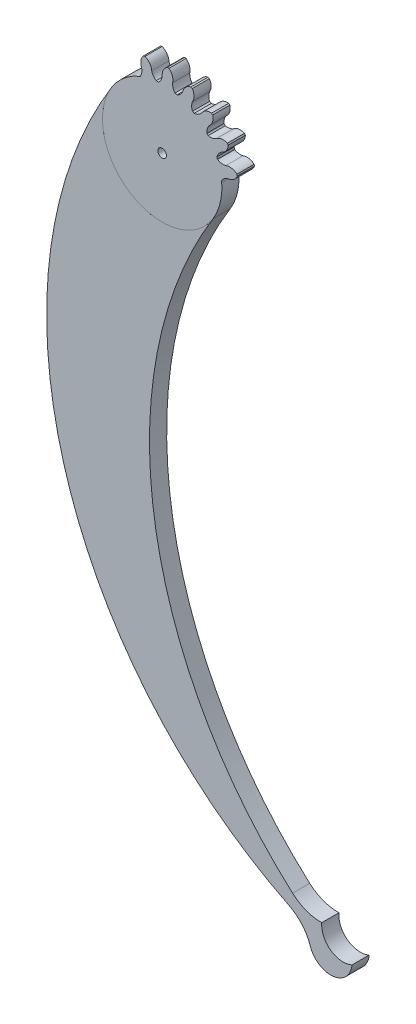
from build123d import *

# Parameters (mm, degrees)
ESQUISSE1_R             = 18
BOSS_EXTRU_1_DEPTH      = 4
ESQUISSE3_R             = 1
ENL_V_MAT_EXTRU_3_DEPTH = 26.768197453
BOSS_EXTRU_2_DEPTH      = 4
CONG_1_R                = 10


with BuildPart() as part:
    # Esquisse1 → Boss.-Extru.1 (new body)
    with BuildSketch(Plane.XY):
        Circle(ESQUISSE1_R)
    extrude(amount=BOSS_EXTRU_1_DEPTH)

    # Esquisse3 → Enlèv. mat.-Extru.3 (cut, through all)
    with BuildSketch(Plane.XY.offset(4)):
        with BuildLine():
            ThreePointArc((13.889472301, 0.971270565), (-7.29270091, -11.860747057), (-5.401914148, 12.832775649))
            Line((-5.401914148, 12.832775649), (-5.100509092, 12.969438951))
            ThreePointArc((-5.100509092, 12.969438951), (-4.765685498, 13.881250232), (-4.803657598, 14.851850443))
            ThreePointArc((-4.803657598, 14.851850443), (-4.957505402, 16.220683727), (-4.36298455, 17.463228963))
            ThreePointArc((-4.36298455, 17.463228963), (-9.368945013, -15.369543563), (17.521453605, 4.122943556))
            ThreePointArc((17.521453605, 4.122943556), (16.689385656, 3.025201949), (15.402187493, 2.534799463))
            ThreePointArc((15.402187493, 2.534799463), (14.540813003, 2.137466087), (13.889472301, 1.447832043))
            Line((13.889472301, 1.447832043), (13.889472301, 0.971270565))
        make_face()
        with BuildLine():
            ThreePointArc((11.000443663, 11.074422202), (10.524374819, 10.215627293), (10.415766238, 9.239730569))
            ThreePointArc((10.415766238, 9.239730569), (10.462012349, 9.18733394), (10.507994882, 9.134705846))
            Line((10.507994882, 9.134705846), (10.731094032, 8.911606695))
            ThreePointArc((10.731094032, 8.911606695), (11.691932834, 8.886448288), (12.591250594, 9.225670511))
            ThreePointArc((12.591250594, 9.225670511), (13.842476168, 9.801698523), (15.208877287, 9.627567278))
            ThreePointArc((15.208877287, 9.627567278), (13.644120592, 11.740441784), (11.788259754, 13.602828088))
            ThreePointArc((11.788259754, 13.602828088), (11.756646891, 12.225739007), (11.000443663, 11.074422202))
        make_face()
        with BuildLine():
            Line((12.765286048, 5.634000541), (12.874449055, 5.301826936))
            ThreePointArc((12.874449055, 5.301826936), (12.895585113, 5.250208748), (12.916514217, 5.198506303))
            ThreePointArc((12.916514217, 5.198506303), (13.838334104, 4.860248506), (14.81932063, 4.903093306))
            ThreePointArc((14.81932063, 4.903093306), (16.187092013, 5.066112175), (17.433594078, 4.479932758))
            ThreePointArc((17.433594078, 4.479932758), (16.594995048, 6.971810335), (15.402333491, 9.314940849))
            ThreePointArc((15.402333491, 9.314940849), (14.948466893, 8.014410642), (13.874653946, 7.151682723))
            ThreePointArc((13.874653946, 7.151682723), (13.171881983, 6.501088333), (12.765286048, 5.634000541))
        make_face()
        with BuildLine():
            ThreePointArc((-4.005414493, 17.548693819), (-2.913274427, 16.709287014), (-2.431510322, 15.418830872))
            ThreePointArc((-2.431510322, 15.418830872), (-2.060789897, 14.584674949), (-1.415325051, 13.939210103))
            Line((-1.415325051, 13.939210103), (-0.828029009, 13.939210103))
            ThreePointArc((-0.828029009, 13.939210103), (-0.252520041, 14.694227343), (0, 15.609375))
            ThreePointArc((0, 15.609375), (0.274865703, 16.959124071), (1.222917541, 17.958409526))
            ThreePointArc((1.222917541, 17.958409526), (-1.40625, 17.944984284), (-4.005414493, 17.548693819))
        make_face()
        with BuildLine():
            ThreePointArc((9.141071212, 12.652802258), (10.154306768, 13.585930018), (11.50798377, 13.840748157))
            ThreePointArc((11.50798377, 13.840748157), (9.368945013, 15.369543563), (7.030015125, 16.570422063))
            ThreePointArc((7.030015125, 16.570422063), (7.423724348, 15.250434656), (7.058528078, 13.922276009))
            ThreePointArc((7.058528078, 13.922276009), (6.869836592, 12.962423447), (7.063912165, 12.003645011))
            Line((7.063912165, 12.003645011), (7.465689298, 11.781332023))
            ThreePointArc((7.465689298, 11.781332023), (8.388832813, 12.052786521), (9.141071212, 12.652802258))
        make_face()
        with BuildLine():
            ThreePointArc((6.690123005, 16.710543204), (4.184417725, 17.506874316), (1.589435797, 17.9296875))
            ThreePointArc((1.589435797, 17.9296875), (2.37025361, 16.794920012), (2.431510322, 15.418830872))
            ThreePointArc((2.431510322, 15.418830872), (2.537604324, 14.478038859), (2.985925197, 13.644160005))
            Line((2.985925197, 13.644160005), (3.460890209, 13.499921317))
            ThreePointArc((3.460890209, 13.499921317), (4.266125885, 14.042940985), (4.803657598, 14.851850443))
            ThreePointArc((4.803657598, 14.851850443), (5.480558287, 16.051508379), (6.690123005, 16.710543204))
        make_face()
        Circle(ESQUISSE3_R)
    extrude(amount=-ENL_V_MAT_EXTRU_3_DEPTH, mode=Mode.SUBTRACT)


with BuildPart() as body_2:
    # Esquisse4 → Boss.-Extru.2 (new body)
    with BuildSketch(Plane.XY.offset(4)):
        with BuildLine():
            ThreePointArc((34.662895709, -139.460875386), (38.133110698, -146.180749057), (44.283317366, -141.77915251))
            ThreePointArc((44.283317366, -141.77915251), (39.304454281, -141.319889646), (37.212756046, -136.7784363))
            ThreePointArc((37.212756046, -136.7784363), (36.156932302, -137.434905039), (35.295715434, -138.331576935))
            ThreePointArc((35.295715434, -138.331576935), (-1.39226634, -77.277858146), (11.860747007, -7.292700991))
            ThreePointArc((11.860747007, -7.292700991), (-7.29270108, -11.860746952), (-11.860746898, 7.292701169))
            ThreePointArc((-11.860746898, 7.292701169), (-22.174309584, -76.728115021), (34.662895709, -139.460875386))
        make_face()
    extrude(amount=-BOSS_EXTRU_2_DEPTH)

    # Congé1
    # the kernel refuses this fillet: 10 mm, written as the material it adds along each edge
    with BuildSketch(Plane(origin=(35.295715434, -138.331576935, 4), x_dir=(0.7769969213307092, 0.6295043957293704, 0), z_dir=(0, 0, -1))) as cong_1_piece_1_section:
        with BuildLine():
            CenterArc((8.651939918, -7.858086939), CONG_1_R, 128.204465459, 42.598753979)
            Line((-1.219512554, -6.259829735), (-1.416941604, -6.22786459))
            ThreePointArc((-1.416941604, -6.22786459), (-0.855978817, -3.081946873), (-0.194990134, 0.044484239))
            Line((-0.194990134, 0.044484239), (0.04934487, 0.19381714))
            ThreePointArc((0.04934487, 0.19381714), (1.233621755, 0.045428502), (2.343549582, 0.157161739))
            Line((2.343549582, 0.157161739), (2.46724351, 0))
        make_face()
    cong_1_piece_1 = extrude(amount=4, mode=Mode.PRIVATE)
    cong_1_piece_1 = cong_1_piece_1 - Plane(origin=(42.191619131, -137.237699164, 2), x_dir=(0.4183396470439297, -0.9082906691754354, 0), z_dir=(0, 0, 1)) * Cylinder(5, 34, mode=Mode.PRIVATE)
    add(cong_1_piece_1)
    with BuildSketch(Plane(origin=(34.662895709, -139.460875386, 4), x_dir=(-0.030637951982491078, -0.9995305477564548, 0), z_dir=(0, 0, -1))) as cong_1_piece_2:
        with BuildLine():
            CenterArc((6.86373477, 9.392671944), CONG_1_R, 204.674520586, 45.254332631)
            Line((-2.22320436, 5.218041752), (-2.404943142, 5.134549148))
            ThreePointArc((-2.404943142, 5.134549148), (-1.259222511, 2.546125603), (-0.186109843, -0.073233369))
            Line((-0.186109843, -0.073233369), (0.068637348, -0.187853439))
            ThreePointArc((0.068637348, -0.187853439), (1.715933693, 0.103664028), (3.363230038, -0.187853439))
            Line((3.363230038, -0.187853439), (3.431867385, 0))
        make_face()
    extrude(amount=4)


solid = Compound([part.part, body_2.part])
